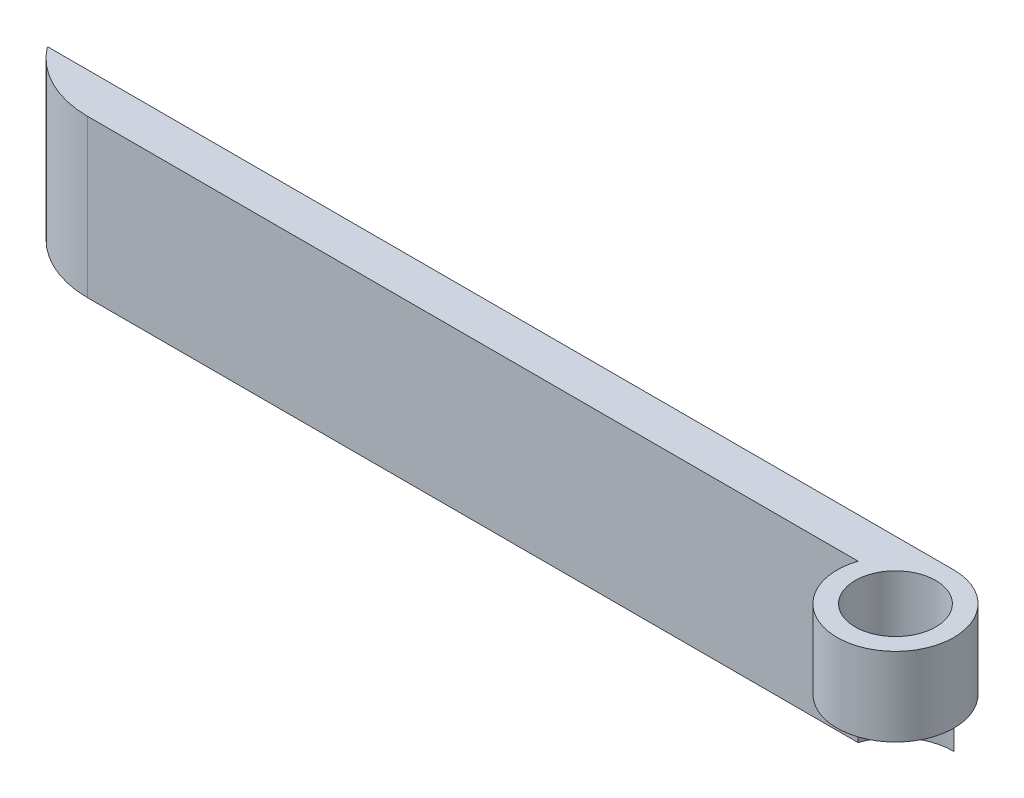
from build123d import *

# Parameters (mm, degrees)
CROQUIS1_R                   = 2.9
CROQUIS1_R_2                 = 2
SALIENTE_EXTRUIR1_DEPTH      = 3.9
SALIENTE_EXTRUIR2_DEPTH      = 3.9
SALIENTE_EXTRUIR2_DEPTH_BACK = 3.9
REDONDEO1_R                  = 5


with BuildPart() as part:
    # Croquis1 → Saliente-Extruir1 (new body)
    with BuildSketch(Plane(origin=(0, 0, 0), x_dir=(1, 0, 0), z_dir=(0, 1, 0))):
        with Locations(Location((0, 0, 0), (0, 0, 270))):
            Circle(CROQUIS1_R)
        with Locations(Location((0, 0, 0), (0, 0, 270))):
            Circle(CROQUIS1_R_2, mode=Mode.SUBTRACT)
    extrude(amount=SALIENTE_EXTRUIR1_DEPTH)

    # Croquis2 → Saliente-Extruir2 (add, two sides: drawn at the far end of the back side and taken through both)
    with BuildSketch(Plane.XZ.offset(-SALIENTE_EXTRUIR2_DEPTH_BACK)):
        with BuildLine():
            Line((-45, -2.9), (0, -2.9))
            ThreePointArc((0, -2.9), (-1.702938637, -2.347338919), (-2.75680975, -0.9))
            Line((-2.75680975, -0.9), (-45, -0.9))
            Line((-45, -0.9), (-45, -2.9))
        make_face()
    extrude(amount=SALIENTE_EXTRUIR2_DEPTH + SALIENTE_EXTRUIR2_DEPTH_BACK)

    # Redondeo1
    # the kernel refuses this fillet: 5 mm, written as the material it takes off along each edge
    with BuildSketch(Plane(origin=(-45, 13.9, -0.9), x_dir=(0, 0, -1), z_dir=(0, -1, 0))) as redondeo1_piece_1:
        with BuildLine():
            CenterArc((5, 4), REDONDEO1_R, 180, 53.130102354)
            Line((0, 4), (-0.1, 4))
            Line((-0.1, 4), (-0.1, 0))
            Line((-0.1, 0), (0, -0.1))
            ThreePointArc((0, -0.1), (1, -0.1), (1.94, -0.08))
            Line((1.94, -0.08), (2, 0))
        make_face()
    extrude(amount=27.8, mode=Mode.SUBTRACT)


solid = part.part
